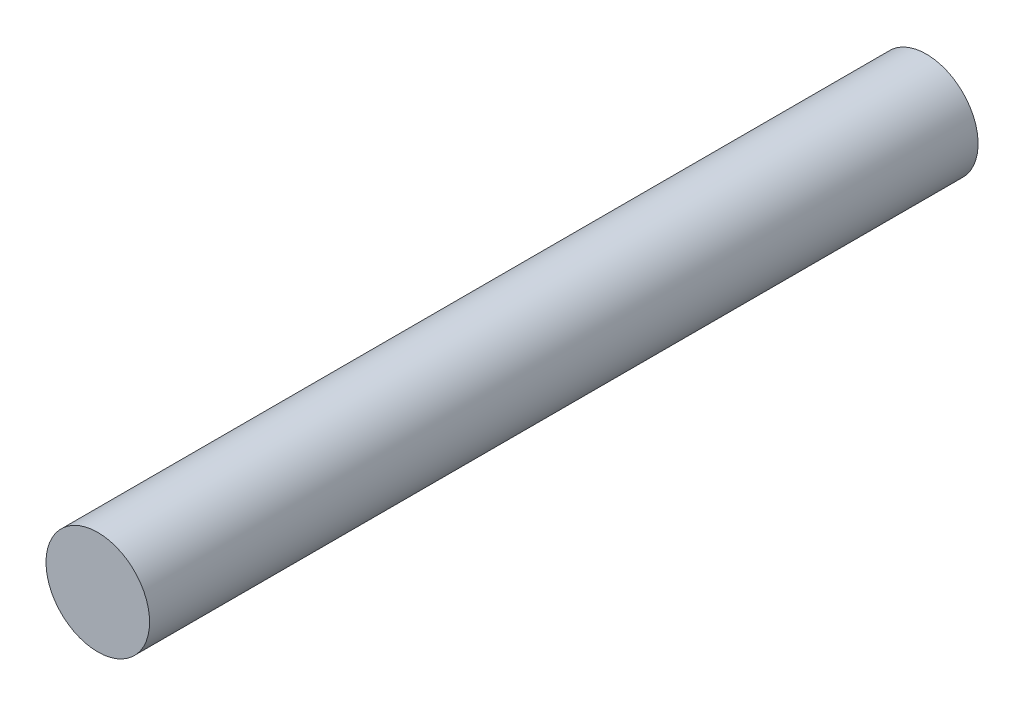
from build123d import *

# Parameters (mm, degrees)
BOSS_EXTRUDE1_START     = -101.577628265
BOSS_EXTRUDE1_OUTLINE_R = 6.35
BOSS_EXTRUDE1_DEPTH     = 101.577628265


# Read off the part's stored shape, not the designer's step: Boss-Extrude1
with BuildPart() as part:
    # Boss-Extrude1 outline → Boss-Extrude1 (new body)
    with BuildSketch(Plane(origin=(0, 0, -22.86), x_dir=(-1, 0, 0), z_dir=(0, 0, -1)).offset(BOSS_EXTRUDE1_START)):
        Circle(BOSS_EXTRUDE1_OUTLINE_R)
    extrude(amount=BOSS_EXTRUDE1_DEPTH)


solid = part.part
